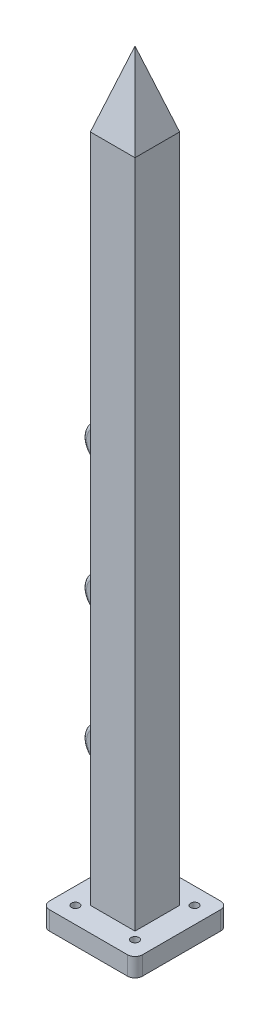
from build123d import *

# Parameters (mm, degrees)
SKETCH1_W                = 25
SKETCH1_H                = 25
BOSS_EXTRUDE1_DEPTH      = 5
SKETCH2_R                = 1.05
CUT_EXTRUDE1_DEPTH       = 5
FILLET1_R                = 2
SKETCH3_W                = 12
SKETCH3_H                = 12
BOSS_EXTRUDE2_DEPTH      = 200
SKETCH4_W                = 5
SKETCH4_H                = 5
CUT_EXTRUDE2_DEPTH       = 140
SKETCH5_W                = 5
SKETCH5_H                = 5
BOSS_EXTRUDE3_DEPTH      = 20
CUT_EXTRUDE6_DEPTH       = 20
CUT_EXTRUDE7_DEPTH       = 20
BOSS_EXTRUDE4_DEPTH      = 3
BOSS_EXTRUDE4_DEPTH_BACK = 3
BOSS_EXTRUDE4_START      = -6
SKETCH12_R               = 5
SKETCH12_R_2             = 1
FILLET2_R                = 1


with BuildPart() as part:
    # Sketch1 → Boss-Extrude1 (new body)
    with BuildSketch(Plane(origin=(0, 0, 0), x_dir=(1, 0, 0), z_dir=(0, 1, 0))):
        with Locations((12.5, 12.5)):
            Rectangle(SKETCH1_W, SKETCH1_H)
    extrude(amount=BOSS_EXTRUDE1_DEPTH)

    # Sketch2 → Cut-Extrude1 (cut)
    with BuildSketch(Plane(origin=(0, 5, 0), x_dir=(1, 0, 0), z_dir=(0, 1, 0))):
        with Locations(Location((4.5, 4.5, 0), (0, 0, 270))):
            Circle(SKETCH2_R)
        with Locations(Location((20.5, 4.5, 0), (0, 0, 270))):
            Circle(SKETCH2_R)
        with Locations(Location((20.5, 20.5, 0), (0, 0, 270))):
            Circle(SKETCH2_R)
        with Locations(Location((4.5, 20.5, 0), (0, 0, 270))):
            Circle(SKETCH2_R)
    extrude(amount=-CUT_EXTRUDE1_DEPTH, mode=Mode.SUBTRACT)

    # Fillet1
    fillet1_edges = [part.edges().sort_by_distance(p)[0] for p in [
        (0, 2.5, -25),
        (25, 2.5, -25),
        (25, 2.5, 0),
        (0, 2.5, 0),
    ]]
    fillet(fillet1_edges, radius=FILLET1_R)

    # Sketch3 → Boss-Extrude2 (add)
    with BuildSketch(Plane(origin=(0, 5, 0), x_dir=(1, 0, 0), z_dir=(0, 1, 0))):
        with Locations((12.5, 12.5)):
            Rectangle(SKETCH3_W, SKETCH3_H)
    extrude(amount=BOSS_EXTRUDE2_DEPTH)

    # Sketch4 → Cut-Extrude2 (cut)
    with BuildSketch(Plane(origin=(0, 205, 0), x_dir=(1, 0, 0), z_dir=(0, 1, 0))):
        with Locations((12.5, 12.5)):
            Rectangle(SKETCH4_W, SKETCH4_H)
    extrude(amount=-CUT_EXTRUDE2_DEPTH, mode=Mode.SUBTRACT)

    # Sketch5 → Boss-Extrude3 (add)
    with BuildSketch(Plane(origin=(0, 205, 0), x_dir=(1, 0, 0), z_dir=(0, 1, 0))):
        with Locations((12.5, 12.5)):
            Rectangle(SKETCH5_W, SKETCH5_H)
    extrude(amount=-BOSS_EXTRUDE3_DEPTH)

    # Sketch10 → Cut-Extrude6 (cut)
    with BuildSketch(Plane.ZY.offset(-6.5)):
        Polygon((-6.5, 185), (-6.5, 205), (-12.5, 205), align=None)
        Polygon((-18.5, 185), (-12.5, 205), (-18.5, 205), align=None)
    extrude(amount=-CUT_EXTRUDE6_DEPTH, mode=Mode.SUBTRACT)

    # Sketch11 → Cut-Extrude7 (cut)
    with BuildSketch(Plane.XY.offset(-6.5)):
        Polygon((6.5, 205), (6.5, 185), (12.5, 205), align=None)
        Polygon((18.5, 205), (12.5, 205), (18.5, 185), align=None)
    extrude(amount=-CUT_EXTRUDE7_DEPTH, mode=Mode.SUBTRACT)

    # Sketch12 → Boss-Extrude4 (add, two sides: drawn at the far end of the back side and taken through both)
    # profile 1 of 3: a face of its own
    with BuildSketch(Plane(origin=(0, 0, -18.5), x_dir=(-1, 0, 0), z_dir=(0, 0, -1)).offset(BOSS_EXTRUDE4_START - BOSS_EXTRUDE4_DEPTH_BACK)):
        with Locations((-6.5, 40)):
            Circle(SKETCH12_R)
        with Locations((-4.5, 40)):
            Circle(SKETCH12_R_2, mode=Mode.SUBTRACT)
    # profile 2 of 3: a face of its own
    with BuildSketch(Plane(origin=(0, 0, -18.5), x_dir=(-1, 0, 0), z_dir=(0, 0, -1)).offset(BOSS_EXTRUDE4_START - BOSS_EXTRUDE4_DEPTH_BACK)):
        with Locations((-6.5, 75)):
            Circle(SKETCH12_R)
        with Locations((-4.5, 75)):
            Circle(SKETCH12_R_2, mode=Mode.SUBTRACT)
    # profile 3 of 3: a face of its own
    with BuildSketch(Plane(origin=(0, 0, -18.5), x_dir=(-1, 0, 0), z_dir=(0, 0, -1)).offset(BOSS_EXTRUDE4_START - BOSS_EXTRUDE4_DEPTH_BACK)):
        with Locations((-6.5, 110)):
            Circle(SKETCH12_R)
        with Locations((-4.5, 110)):
            Circle(SKETCH12_R_2, mode=Mode.SUBTRACT)
    extrude(amount=BOSS_EXTRUDE4_DEPTH + BOSS_EXTRUDE4_DEPTH_BACK)

    # Fillet2
    fillet2_edges = [part.edges().sort_by_distance(p)[0] for p in [
        (6.5, 40, -15.5),
        (6.5, 45, -12.5),
        (6.5, 35, -12.5),
        (6.5, 40, -9.5),
        (1.5, 40, -9.5),
        (1.5, 40, -15.5),
        (6.5, 75, -15.5),
        (6.5, 75, -9.5),
        (1.5, 75, -15.5),
        (1.5, 75, -9.5),
        (6.5, 70, -12.5),
        (6.5, 80, -12.5),
        (11.5, 110, -10),
        (6.5, 110, -15.5),
        (6.5, 110, -9.5),
        (1.5, 110, -15.5),
        (1.5, 110, -9.5),
        (6.5, 105, -12.5),
        (6.5, 115, -12.5),
    ]]
    fillet(fillet2_edges, radius=FILLET2_R - 0.0001)  # a hair under: the kernel refuses the full size


solid = part.part
